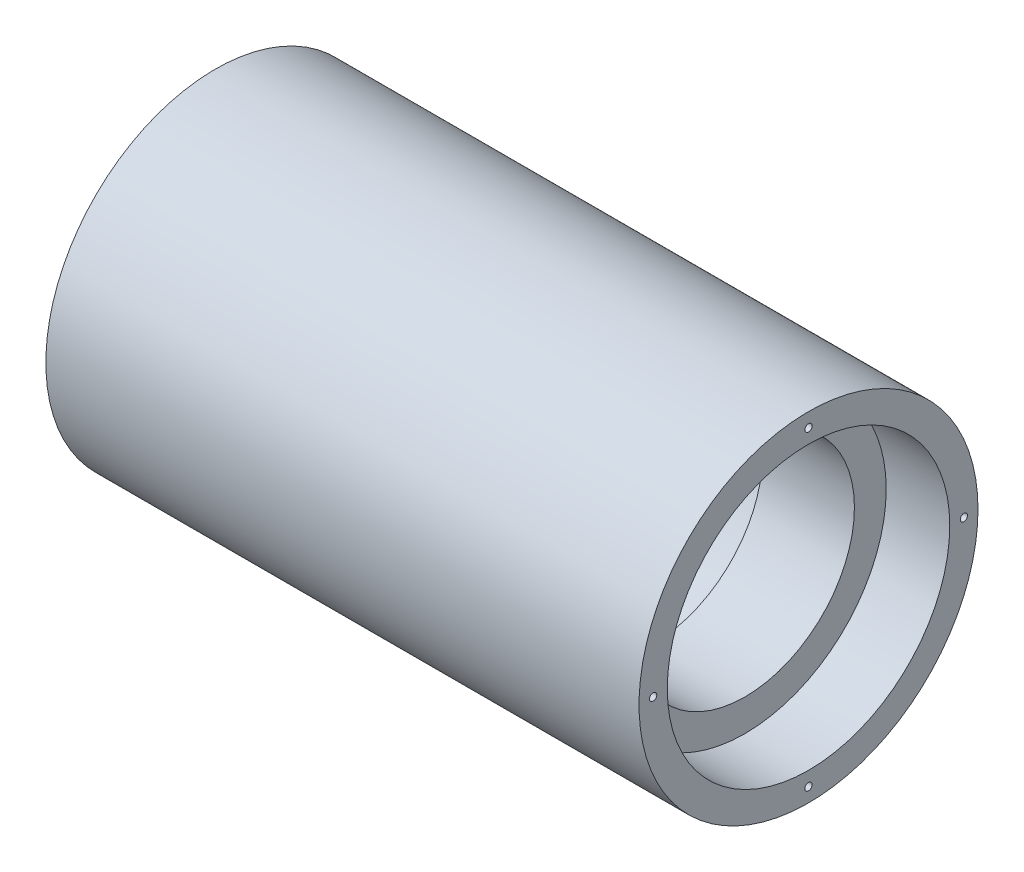
from build123d import *

# Parameters (mm, degrees)
BOSS_EXTRUDE1_DEPTH          = 84
BOSS_EXTRUDE1_DEPTH_BACK     = 84
SKETCH2_R                    = 48
CUT_EXTRUDE1_DEPTH           = 40
CUT_EXTRUDE1_DEPTH_BACK      = 50
SKETCH3_R                    = 40
CUT_EXTRUDE2_DEPTH           = 109
CUT_EXTRUDE2_DEPTH_BACK      = 109
SKETCH4_R                    = 31
FILLET1_R                    = 5
CUT_EXTRUDE3_REACH           = 176
CUT_EXTRUDE3_START           = -66
SKETCH5_R                    = 40
SKETCH6_R                    = 34
CUT_EXTRUDE4_DEPTH           = 18.4
M2_5X0_45_TAPPED_HOLE1_D     = 2.05
M2_5X0_45_TAPPED_HOLE1_DEPTH = 8
M2_5X0_45_TAPPED_HOLE1_TIP   = 0.615882135
M2_5X0_45_TAPPED_HOLE2_D     = 2.05
M2_5X0_45_TAPPED_HOLE2_DEPTH = 8
M2_5X0_45_TAPPED_HOLE2_TIP   = 0.615882135


with BuildPart() as part:
    # Sketch2 → Boss-Extrude1 (new, two sides: drawn at the far end of the back side and taken through both)
    with BuildSketch(Plane(origin=(0, 0, 0), x_dir=(0, -1, 0), z_dir=(1, 0, 0)).offset(-BOSS_EXTRUDE1_DEPTH_BACK)):
        Circle(SKETCH2_R)
    extrude(amount=BOSS_EXTRUDE1_DEPTH + BOSS_EXTRUDE1_DEPTH_BACK)

    # Sketch3 → Cut-Extrude1 (cut, two sides: drawn at the far end of the back side and taken through both)
    with BuildSketch(Plane(origin=(0, 0, 0), x_dir=(0, -1, 0), z_dir=(1, 0, 0)).offset(-CUT_EXTRUDE1_DEPTH_BACK)):
        Circle(SKETCH3_R)
    extrude(amount=CUT_EXTRUDE1_DEPTH + CUT_EXTRUDE1_DEPTH_BACK, mode=Mode.SUBTRACT)

    # Sketch4 → Cut-Extrude2 (cut, two sides: drawn at the far end of the back side and taken through both)
    with BuildSketch(Plane(origin=(0, 0, 0), x_dir=(0, -1, 0), z_dir=(1, 0, 0)).offset(-CUT_EXTRUDE2_DEPTH_BACK)):
        Circle(SKETCH4_R)
    extrude(amount=CUT_EXTRUDE2_DEPTH + CUT_EXTRUDE2_DEPTH_BACK, mode=Mode.SUBTRACT)

    # Fillet1
    fillet1_edges = [part.edges().sort_by_distance(p)[0] for p in [
        (40, 40, 0),
        (-50, 40, 0),
    ]]
    fillet(fillet1_edges, radius=FILLET1_R)

    # Sketch5 → Cut-Extrude3 (cut, up to next)
    with BuildSketch(Plane(origin=(0, 0, 0), x_dir=(0, 0, -1), z_dir=(-1, 0, 0)).offset(CUT_EXTRUDE3_START), mode=Mode.PRIVATE) as cut_extrude3_sk1:
        Circle(SKETCH5_R)
    cut_extrude3_tool1 = extrude(cut_extrude3_sk1.sketch, amount=-CUT_EXTRUDE3_REACH, mode=Mode.PRIVATE) & part.part
    add(cut_extrude3_tool1.solids().sort_by_distance((66, 0, 0))[0], mode=Mode.SUBTRACT)

    # Sketch6 → Cut-Extrude4 (cut)
    with BuildSketch(Plane.ZY.offset(84)):
        Circle(SKETCH6_R)
    extrude(amount=-CUT_EXTRUDE4_DEPTH, mode=Mode.SUBTRACT)

    # M2.5x0.45 Tapped Hole1
    with Locations(Plane(origin=(84, 0, 0), x_dir=(0, 0, -1), z_dir=(1, 0, 0))):
        with Locations((256.353874164, 80.103153953), (0, -44), (-44, 0), (0, 44), (44, 0)):
            Hole(M2_5X0_45_TAPPED_HOLE1_D / 2, depth=M2_5X0_45_TAPPED_HOLE1_DEPTH)
            with Locations((0, 0, -(M2_5X0_45_TAPPED_HOLE1_DEPTH + M2_5X0_45_TAPPED_HOLE1_TIP / 2))):  # 118° drill point
                Cone(0, M2_5X0_45_TAPPED_HOLE1_D / 2, M2_5X0_45_TAPPED_HOLE1_TIP, mode=Mode.SUBTRACT)

    # M2.5x0.45 Tapped Hole2
    with Locations(Plane.ZY.offset(84)):
        with Locations((0, 41), (0, -41), (41, 0), (-41, 0)):
            Hole(M2_5X0_45_TAPPED_HOLE2_D / 2, depth=M2_5X0_45_TAPPED_HOLE2_DEPTH)
            with Locations((0, 0, -(M2_5X0_45_TAPPED_HOLE2_DEPTH + M2_5X0_45_TAPPED_HOLE2_TIP / 2))):  # 118° drill point
                Cone(0, M2_5X0_45_TAPPED_HOLE2_D / 2, M2_5X0_45_TAPPED_HOLE2_TIP, mode=Mode.SUBTRACT)


solid = part.part
